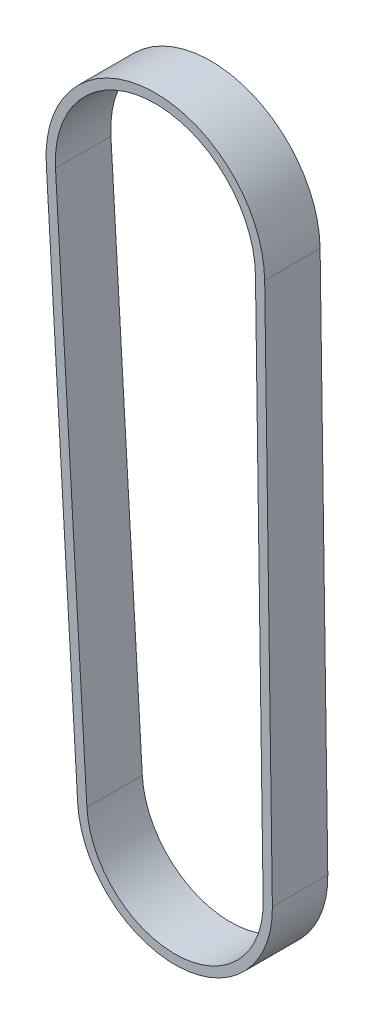
from build123d import *

# Parameters (mm, degrees)
EXTRUDE_THIN1_DEPTH = 9


with BuildPart() as part:
    # Sketch2 → Extrude-Thin1 (new body)
    with BuildSketch(Plane.XY):
        with BuildLine():
            Line((17.748190294, 0.253458642), (18.997331545, -87.216420002))
            ThreePointArc((18.997331545, -87.216420002), (3.749183153, -103.255899934), (-12.622053639, -88.364508066))
            Line((-12.622053639, -88.364508066), (-17.719835617, -1.034372129))
            ThreePointArc((-17.719835617, -1.034372129), (-0.644071441, 17.738310855), (17.748190294, 0.253458642))
        make_face()
        with BuildLine():
            Line((16.248343227, 0.232039602), (17.497484478, -87.237839042))
            ThreePointArc((17.497484478, -87.237839042), (3.694754581, -101.756887749), (-11.124602742, -88.277096336))
            Line((-11.124602742, -88.277096336), (-16.22238472, -0.9469604))
            ThreePointArc((-16.22238472, -0.9469604), (-0.589642868, 16.23929867), (16.248343227, 0.232039602))
        make_face(mode=Mode.SUBTRACT)
    extrude(amount=-EXTRUDE_THIN1_DEPTH)


solid = part.part
